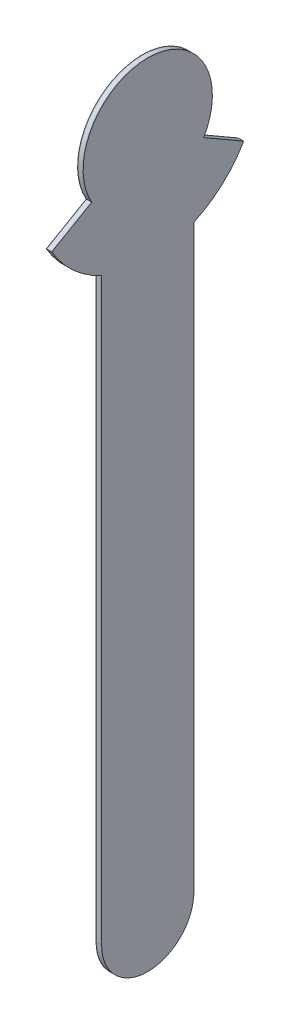
from build123d import *

# Parameters (mm, degrees)
BOSS_EXTRUDE1_DEPTH = 0.25
BOSS_EXTRUDE2_DEPTH = 2.5
BOSS_EXTRUDE3_DEPTH = 0.25


with BuildPart() as part:
    # Sketch1 → Boss-Extrude1 (new body)
    with BuildSketch(Plane(origin=(0, 0, 0), x_dir=(0, 0, -1), z_dir=(1, 0, 0))):
        with BuildLine():
            Line((-25, -54.543560573), (-25, -368.6))
            ThreePointArc((-25, -368.6), (0, -393.6), (25, -368.6))
            Line((25, -368.6), (25, -54.543560573))
            ThreePointArc((25, -54.543560573), (40.390167668, -44.369295191), (51.961524227, -30))
            Line((51.961524227, -30), (30.310889132, -17.5))
            ThreePointArc((30.310889132, -17.5), (0, 35), (-30.310889132, -17.5))
            Line((-30.310889132, -17.5), (-51.961524227, -30))
            ThreePointArc((-51.961524227, -30), (-40.390167668, -44.369295191), (-25, -54.543560573))
        make_face()
    extrude(amount=-BOSS_EXTRUDE1_DEPTH)


with BuildPart() as body_2:
    # Sketch2 → Boss-Extrude2 (new body)
    with BuildSketch(Plane.ZY.offset(0.25)):
        with BuildLine():
            Line((25, -368.6), (25, -54.543560573))
            ThreePointArc((25, -54.543560573), (40.390167668, -44.369295191), (51.961524227, -30))
            Line((51.961524227, -30), (30.310889132, -17.5))
            ThreePointArc((30.310889132, -17.5), (0, 35), (-30.310889132, -17.5))
            Line((-30.310889132, -17.5), (-51.961524227, -30))
            ThreePointArc((-51.961524227, -30), (-40.390167668, -44.369295191), (-25, -54.543560573))
            Line((-25, -54.543560573), (-25, -368.6))
            ThreePointArc((-25, -368.6), (0, -393.6), (25, -368.6))
        make_face()
    extrude(amount=BOSS_EXTRUDE2_DEPTH)


with BuildPart() as body_3:
    # Sketch3 → Boss-Extrude3 (new body)
    with BuildSketch(Plane.ZY.offset(2.75)):
        with BuildLine():
            Line((25, -368.6), (25, -54.543560573))
            ThreePointArc((25, -54.543560573), (40.390167668, -44.369295191), (51.961524227, -30))
            Line((51.961524227, -30), (30.310889132, -17.5))
            ThreePointArc((30.310889132, -17.5), (0, 35), (-30.310889132, -17.5))
            Line((-30.310889132, -17.5), (-51.961524227, -30))
            ThreePointArc((-51.961524227, -30), (-40.390167668, -44.369295191), (-25, -54.543560573))
            Line((-25, -54.543560573), (-25, -368.6))
            ThreePointArc((-25, -368.6), (0, -393.6), (25, -368.6))
        make_face()
    extrude(amount=BOSS_EXTRUDE3_DEPTH)


solid = Compound([part.part, body_2.part, body_3.part])
